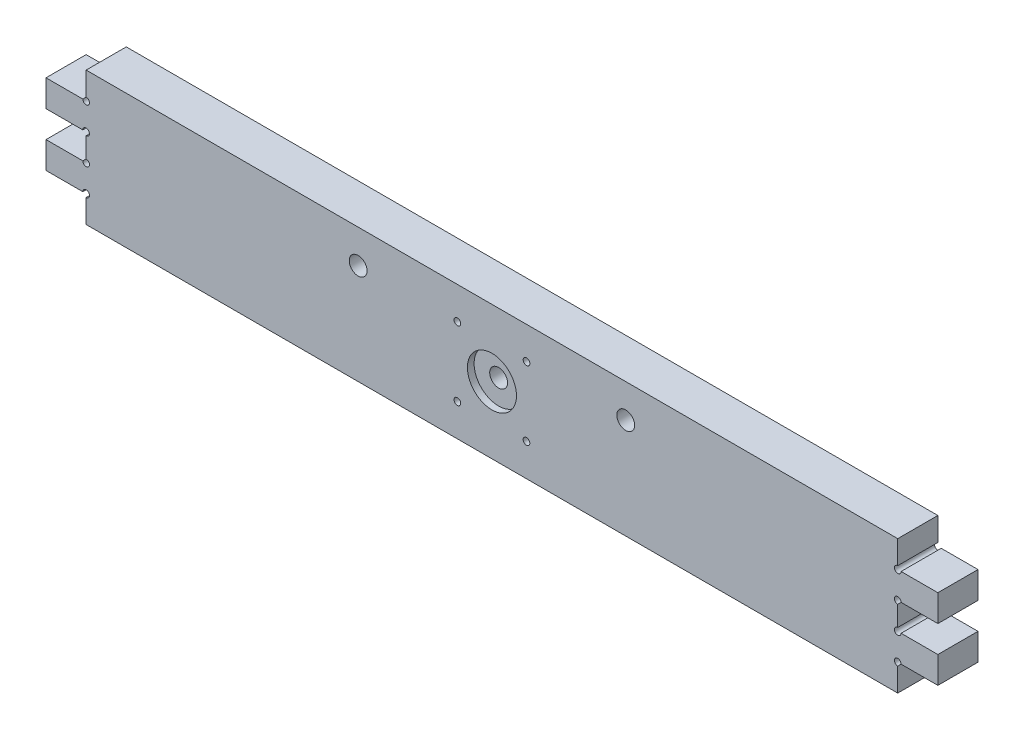
from build123d import *

# Parameters (mm, degrees)
SKETCH1_R           = 4
BOSS_EXTRUDE1_DEPTH = 18
CUT_EXTRUDE1_REACH  = 205.037
SKETCH2_R           = 1.5
SKETCH3_R           = 11
CUT_EXTRUDE2_DEPTH  = 3


with BuildPart() as part:
    # Sketch1 → Boss-Extrude1 (new body)
    with BuildSketch(Plane.XY):
        with BuildLine():
            Line((-182, -19.5), (-182, -30))
            Line((-182, -30), (182, -30))
            Line((182, -30), (182, -19.5))
            ThreePointArc((182, -19.5), (180.939339828, -16.939339828), (183.5, -18))
            Line((183.5, -18), (200, -18))
            Line((200, -18), (200, -6))
            Line((200, -6), (183.5, -6))
            ThreePointArc((183.5, -6), (180.939339828, -7.060660172), (182, -4.5))
            Line((182, -4.5), (182, 4.5))
            ThreePointArc((182, 4.5), (180.939339828, 7.060660172), (183.5, 6))
            Line((183.5, 6), (200, 6))
            Line((200, 6), (200, 18))
            Line((200, 18), (183.5, 18))
            ThreePointArc((183.5, 18), (180.939339828, 16.939339828), (182, 19.5))
            Line((182, 19.5), (182, 30))
            Line((182, 30), (-182, 30))
            Line((-182, 30), (-182, 19.5))
            ThreePointArc((-182, 19.5), (-180.939339828, 16.939339828), (-183.5, 18))
            Line((-183.5, 18), (-200, 18))
            Line((-200, 18), (-200, 6))
            Line((-200, 6), (-183.5, 6))
            ThreePointArc((-183.5, 6), (-180.939339828, 7.060660172), (-182, 4.5))
            Line((-182, 4.5), (-182, -4.5))
            ThreePointArc((-182, -4.5), (-180.939339828, -7.060660172), (-183.5, -6))
            Line((-183.5, -6), (-200, -6))
            Line((-200, -6), (-200, -18))
            Line((-200, -18), (-183.5, -18))
            ThreePointArc((-183.5, -18), (-180.939339828, -16.939339828), (-182, -19.5))
        make_face()
        with Locations((-60, 15)):
            Circle(SKETCH1_R, mode=Mode.SUBTRACT)
        Circle(SKETCH1_R, mode=Mode.SUBTRACT)
        with Locations((60, 15)):
            Circle(SKETCH1_R, mode=Mode.SUBTRACT)
    extrude(amount=BOSS_EXTRUDE1_DEPTH)

    # Sketch2 → Cut-Extrude1 (cut, up to next)
    with BuildSketch(Plane.XY.offset(18), mode=Mode.PRIVATE) as cut_extrude1_sk1:
        with Locations((15.495, 15.495)):
            Circle(SKETCH2_R)
    cut_extrude1_tool1 = extrude(cut_extrude1_sk1.sketch, amount=-CUT_EXTRUDE1_REACH, mode=Mode.PRIVATE) & part.part
    # Sketch2 → Cut-Extrude1 (cut, up to next)
    with BuildSketch(Plane.XY.offset(18), mode=Mode.PRIVATE) as cut_extrude1_sk2:
        with Locations((-15.495, 15.495)):
            Circle(SKETCH2_R)
    cut_extrude1_tool2 = extrude(cut_extrude1_sk2.sketch, amount=-CUT_EXTRUDE1_REACH, mode=Mode.PRIVATE) & part.part
    # Sketch2 → Cut-Extrude1 (cut, up to next)
    with BuildSketch(Plane.XY.offset(18), mode=Mode.PRIVATE) as cut_extrude1_sk3:
        with Locations((15.495, -15.495)):
            Circle(SKETCH2_R)
    cut_extrude1_tool3 = extrude(cut_extrude1_sk3.sketch, amount=-CUT_EXTRUDE1_REACH, mode=Mode.PRIVATE) & part.part
    # Sketch2 → Cut-Extrude1 (cut, up to next)
    with BuildSketch(Plane.XY.offset(18), mode=Mode.PRIVATE) as cut_extrude1_sk4:
        with Locations((-15.495, -15.495)):
            Circle(SKETCH2_R)
    cut_extrude1_tool4 = extrude(cut_extrude1_sk4.sketch, amount=-CUT_EXTRUDE1_REACH, mode=Mode.PRIVATE) & part.part
    add(cut_extrude1_tool1.solids().sort_by_distance((15.495, 15.495, 18))[0], mode=Mode.SUBTRACT)
    add(cut_extrude1_tool2.solids().sort_by_distance((-15.495, 15.495, 18))[0], mode=Mode.SUBTRACT)
    add(cut_extrude1_tool3.solids().sort_by_distance((15.495, -15.495, 18))[0], mode=Mode.SUBTRACT)
    add(cut_extrude1_tool4.solids().sort_by_distance((-15.495, -15.495, 18))[0], mode=Mode.SUBTRACT)

    # Sketch3 → Cut-Extrude2 (cut)
    with BuildSketch(Plane.XY.offset(18)):
        Circle(SKETCH3_R)
    extrude(amount=-CUT_EXTRUDE2_DEPTH, mode=Mode.SUBTRACT)


solid = part.part
